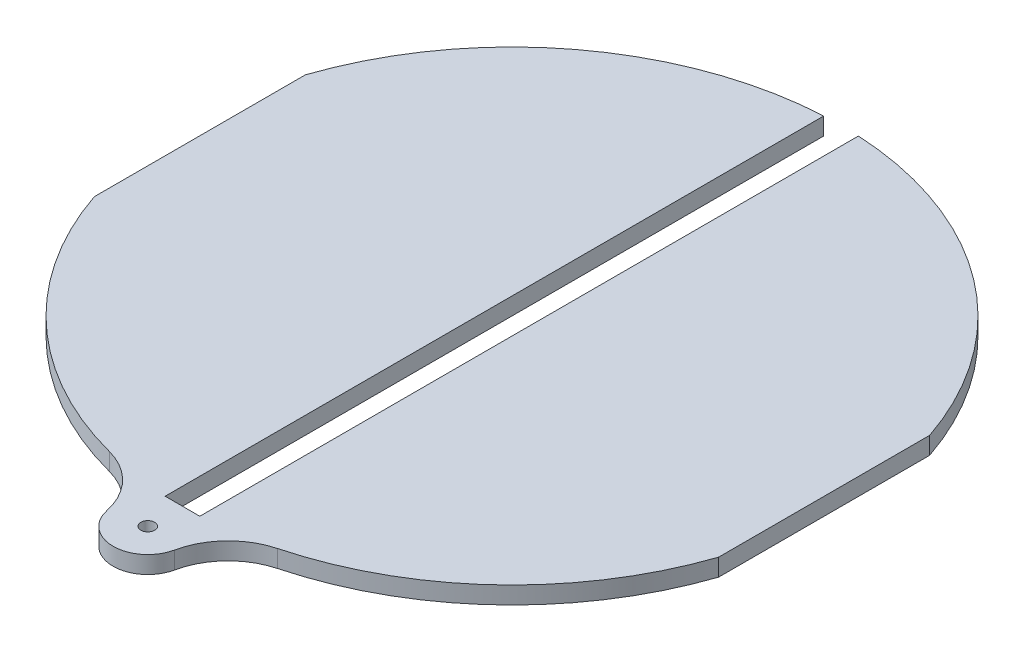
from build123d import *

# Parameters (mm, degrees)
BOSS_EXTRUDE1_DEPTH     = 3.175
SKETCH3_R               = 1.27
CUT_EXTRUDE1_DEPTH      = 91.306287849
CUT_EXTRUDE2_DEPTH      = 91.306287849
CUT_EXTRUDE2_DEPTH_BACK = 91.306287849
FILLET1_R               = 12.7


with BuildPart() as part:
    # Sketch2 → Boss-Extrude1 (new body)
    with BuildSketch(Plane(origin=(0, 0, 0), x_dir=(1, 0, 0), z_dir=(0, 1, 0))):
        with BuildLine():
            Line((3.175, 63.5), (57.15, 63.5))
            Line((57.15, 63.5), (57.15, -63.5))
            Line((57.15, -63.5), (6.35, -63.5))
            ThreePointArc((6.35, -63.5), (0, -69.85), (-6.35, -63.5))
            Line((-6.35, -63.5), (-57.15, -63.5))
            Line((-57.15, -63.5), (-57.15, 63.5))
            Line((-57.15, 63.5), (-3.175, 63.5))
            Line((-3.175, 63.5), (-3.175, -57.15))
            Line((-3.175, -57.15), (3.175, -57.15))
            Line((3.175, -57.15), (3.175, 63.5))
        make_face()
    extrude(amount=BOSS_EXTRUDE1_DEPTH)

    # Sketch3 → Cut-Extrude1 (cut, through all)
    with BuildSketch(Plane(origin=(0, 3.175, 0), x_dir=(1, 0, 0), z_dir=(0, 1, 0))):
        with Locations((0, -63.5)):
            Circle(SKETCH3_R)
    extrude(amount=-CUT_EXTRUDE1_DEPTH, mode=Mode.SUBTRACT)

    # Sketch4 → Cut-Extrude2 (cut, two sides: drawn at the far end of the back side and taken through both)
    with BuildSketch(Plane(origin=(0, 3.175, 0), x_dir=(1, 0, 0), z_dir=(0, 1, 0)).offset(-CUT_EXTRUDE2_DEPTH_BACK)):
        with BuildLine():
            Line((-57.15, -63.5), (-6.35, -63.5))
            Line((-6.35, -63.5), (-6.35, -56.814858518))
            ThreePointArc((-6.35, -56.814858518), (-37.70568739, -43.914136363), (-57.15, -16.137771034))
            Line((-57.15, -16.137771034), (-57.15, -63.5))
        make_face()
        with BuildLine():
            Line((57.15, -63.5), (57.15, -16.137771034))
            ThreePointArc((57.15, -16.137771034), (37.70568739, -43.914136363), (6.35, -56.814858518))
            Line((6.35, -56.814858518), (6.35, -63.5))
            Line((6.35, -63.5), (57.15, -63.5))
        make_face()
        with BuildLine():
            Line((-57.15, 63.5), (-57.15, 22.487771034))
            ThreePointArc((-57.15, 22.487771034), (-36.449476774, 51.243089913), (-3.175, 63.416389426))
            Line((-3.175, 63.416389426), (-3.175, 63.5))
            Line((-3.175, 63.5), (-57.15, 63.5))
        make_face()
        with BuildLine():
            Line((57.15, 63.5), (3.175, 63.5))
            Line((3.175, 63.5), (3.175, 63.416389426))
            ThreePointArc((3.175, 63.416389426), (36.449476774, 51.243089913), (57.15, 22.487771034))
            Line((57.15, 22.487771034), (57.15, 63.5))
        make_face()
    extrude(amount=CUT_EXTRUDE2_DEPTH + CUT_EXTRUDE2_DEPTH_BACK, mode=Mode.SUBTRACT)

    # Fillet1
    fillet1_edges = [part.edges().sort_by_distance(p)[0] for p in [
        (6.35, 1.5875, 56.814858518),
        (-6.35, 1.5875, 56.814858518),
    ]]
    fillet(fillet1_edges, radius=FILLET1_R)


solid = part.part
